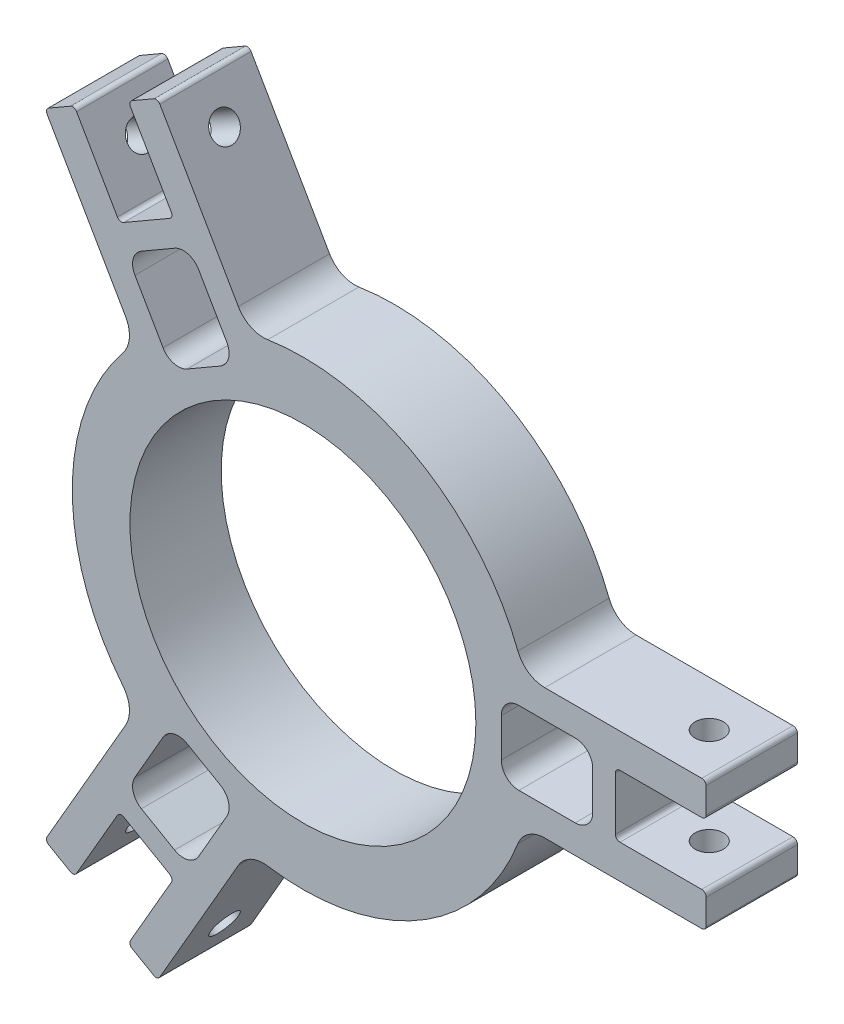
from build123d import *

# Parameters (mm, degrees)
SKETCH1_R           = 38.1
BOSS_EXTRUDE1_DEPTH = 20.1
SKETCH4_R           = 3.125
CUT_EXTRUDE3_DEPTH  = 144.535934685
SKETCH6_R           = 3.125
CUT_EXTRUDE4_DEPTH  = 127.835550541
SKETCH7_R           = 3.125
CUT_EXTRUDE5_DEPTH  = 156.395985719


with BuildPart() as part:
    # Sketch1 → Boss-Extrude1 (new body)
    with BuildSketch(Plane.XY):
        with BuildLine():
            Line((-95.111903665, 93.55868451), (-99.980615655, 90.747732332))
            ThreePointArc((-99.980615655, 90.747732332), (-100.446541481, 90.140525974), (-100.346641059, 89.381706928))
            Line((-100.346641059, 89.381706928), (-91.346641059, 73.79324966))
            ThreePointArc((-91.346641059, 73.79324966), (-91.246740636, 73.034430615), (-91.712666463, 72.427224257))
            Line((-91.712666463, 72.427224257), (-101.854513828, 66.57182595))
            ThreePointArc((-101.854513828, 66.57182595), (-102.613332873, 66.471925528), (-103.220539232, 66.937851354))
            Line((-103.220539232, 66.937851354), (-112.220539232, 82.526308622))
            ThreePointArc((-112.220539232, 82.526308622), (-112.82774559, 82.992234449), (-113.586564635, 82.892334026))
            Line((-113.586564635, 82.892334026), (-118.455276625, 80.081381848))
            ThreePointArc((-118.455276625, 80.081381848), (-118.819948321, 79.484414756), (-118.704168635, 78.7945233))
            Line((-118.704168635, 78.7945233), (-101.414254717, 48.847513936))
            ThreePointArc((-101.414254717, 48.847513936), (-100.582142307, 45.186502855), (-101.963268876, 41.695385184))
            ThreePointArc((-101.963268876, 41.695385184), (-113.159955971, 10.246732396), (-102.420535507, -21.3609947))
            ThreePointArc((-102.420535507, -21.3609947), (-102.19294947, -21.65066375), (-101.963268876, -21.938674838))
            ThreePointArc((-101.963268876, -21.938674838), (-100.582142307, -25.429792509), (-101.414254717, -29.09080359))
            Line((-101.414254717, -29.09080359), (-118.704168635, -59.037812955))
            ThreePointArc((-118.704168635, -59.037812955), (-118.819948321, -59.72770441), (-118.455276625, -60.324671502))
            Line((-118.455276625, -60.324671502), (-113.586564635, -63.13562368))
            ThreePointArc((-113.586564635, -63.13562368), (-112.82774559, -63.235524103), (-112.220539232, -62.769598276))
            Line((-112.220539232, -62.769598276), (-103.220539232, -47.181141008))
            ThreePointArc((-103.220539232, -47.181141008), (-102.613332873, -46.715215182), (-101.854513828, -46.815115605))
            Line((-101.854513828, -46.815115605), (-91.712666463, -52.670513911))
            ThreePointArc((-91.712666463, -52.670513911), (-91.246740636, -53.277720269), (-91.346641059, -54.036539315))
            Line((-91.346641059, -54.036539315), (-100.346641059, -69.624996583))
            ThreePointArc((-100.346641059, -69.624996583), (-100.446541481, -70.383815628), (-99.980615655, -70.991021986))
            Line((-99.980615655, -70.991021986), (-95.111903665, -73.801974164))
            ThreePointArc((-95.111903665, -73.801974164), (-94.41257915, -73.819305571), (-93.873005467, -73.374091694))
            Line((-93.873005467, -73.374091694), (-76.583091549, -43.427082329))
            ThreePointArc((-76.583091549, -43.427082329), (-73.828619155, -40.875946303), (-70.11465928, -40.326478162))
            ThreePointArc((-70.11465928, -40.326478162), (-37.280983502, -34.298767231), (-15.277599113, -9.194292739))
            ThreePointArc((-15.277599113, -9.194292739), (-15.140531376, -8.852362925), (-15.005946754, -8.509448151))
            ThreePointArc((-15.005946754, -8.509448151), (-12.673113448, -5.567798621), (-9.086528644, -4.457923566))
            Line((-9.086528644, -4.457923566), (25.493299193, -4.457923566))
            ThreePointArc((25.493299193, -4.457923566), (26.148652562, -4.213245988), (26.483305381, -3.598947489))
            Line((26.483305381, -3.598947489), (26.483305381, 2.022956867))
            ThreePointArc((26.483305381, 2.022956867), (26.190412162, 2.730063648), (25.483305381, 3.022956867))
            Line((25.483305381, 3.022956867), (7.483305381, 3.022956867))
            ThreePointArc((7.483305381, 3.022956867), (6.7761986, 3.315850085), (6.483305381, 4.022956867))
            Line((6.483305381, 4.022956867), (6.483305381, 15.733753479))
            ThreePointArc((6.483305381, 15.733753479), (6.7761986, 16.44086026), (7.483305381, 16.733753479))
            Line((7.483305381, 16.733753479), (25.483305381, 16.733753479))
            ThreePointArc((25.483305381, 16.733753479), (26.190412162, 17.026646698), (26.483305381, 17.733753479))
            Line((26.483305381, 17.733753479), (26.483305381, 23.355657835))
            ThreePointArc((26.483305381, 23.355657835), (26.148652562, 23.969956334), (25.493299193, 24.214633912))
            Line((25.493299193, 24.214633912), (-9.086528644, 24.214633912))
            ThreePointArc((-9.086528644, 24.214633912), (-12.673113448, 25.324508967), (-15.005946754, 28.266158497))
            ThreePointArc((-15.005946754, 28.266158497), (-36.642935435, 53.687100354), (-69.385740289, 60.190352958))
            ThreePointArc((-69.385740289, 60.190352958), (-69.750394063, 60.138092193), (-70.11465928, 60.083188508))
            ThreePointArc((-70.11465928, 60.083188508), (-73.828619155, 60.632656649), (-76.583091549, 63.183792675))
            Line((-76.583091549, 63.183792675), (-93.873005467, 93.13080204))
            ThreePointArc((-93.873005467, 93.13080204), (-94.41257915, 93.576015917), (-95.111903665, 93.55868451))
        make_face()
        with BuildLine():
            ThreePointArc((-97.942547476, -43.300187739), (-99.748010053, -40.947263099), (-99.360895916, -38.006839299))
            Line((-99.360895916, -38.006839299), (-93.165814799, -27.276644048))
            ThreePointArc((-93.165814799, -27.276644048), (-90.812890159, -25.471181471), (-87.87246636, -25.858295608))
            Line((-87.87246636, -25.858295608), (-80.554551698, -30.083295608))
            ThreePointArc((-80.554551698, -30.083295608), (-78.749089121, -32.436220248), (-79.136203258, -35.376644048))
            Line((-79.136203258, -35.376644048), (-85.331284375, -46.106839299))
            ThreePointArc((-85.331284375, -46.106839299), (-87.684209014, -47.912301876), (-90.624632814, -47.525187739))
            Line((-90.624632814, -47.525187739), (-97.942547476, -43.300187739))
        make_face(mode=Mode.SUBTRACT)
        with Locations((-62.361291636, 9.878355173)):
            Circle(SKETCH1_R, mode=Mode.SUBTRACT)
        with BuildLine():
            Line((-80.554551698, 49.840005954), (-87.87246636, 45.615005954))
            ThreePointArc((-87.87246636, 45.615005954), (-90.812890159, 45.227891817), (-93.165814799, 47.033354394))
            Line((-93.165814799, 47.033354394), (-99.360895916, 57.763549645))
            ThreePointArc((-99.360895916, 57.763549645), (-99.748010053, 60.703973445), (-97.942547476, 63.056898085))
            Line((-97.942547476, 63.056898085), (-90.624632814, 67.281898085))
            ThreePointArc((-90.624632814, 67.281898085), (-87.684209014, 67.669012222), (-85.331284375, 65.863549645))
            Line((-85.331284375, 65.863549645), (-79.136203258, 55.133354394))
            ThreePointArc((-79.136203258, 55.133354394), (-78.749089121, 52.192930594), (-80.554551698, 49.840005954))
        make_face(mode=Mode.SUBTRACT)
        with BuildLine():
            ThreePointArc((1.483305381, 5.653355173), (0.348344158, 2.913316396), (-2.391694619, 1.778355173))
            Line((-2.391694619, 1.778355173), (-14.781856852, 1.778355173))
            ThreePointArc((-14.781856852, 1.778355173), (-17.521895629, 2.913316396), (-18.656856852, 5.653355173))
            Line((-18.656856852, 5.653355173), (-18.656856852, 14.103355173))
            ThreePointArc((-18.656856852, 14.103355173), (-17.521895629, 16.84339395), (-14.781856852, 17.978355173))
            Line((-14.781856852, 17.978355173), (-2.391694619, 17.978355173))
            ThreePointArc((-2.391694619, 17.978355173), (0.348344158, 16.84339395), (1.483305381, 14.103355173))
            Line((1.483305381, 14.103355173), (1.483305381, 5.653355173))
        make_face(mode=Mode.SUBTRACT)
    extrude(amount=BOSS_EXTRUDE1_DEPTH)

    # Sketch4 → Cut-Extrude3 (cut, through all)
    with BuildSketch(Plane(origin=(-30.07793388, -17.365503222, 0), x_dir=(0, 0, -1), z_dir=(0.8660254037844387, 0.49999999999999983, 0))):
        with Locations((-10.05, 119.190143175)):
            Circle(SKETCH4_R)
    extrude(amount=-CUT_EXTRUDE3_DEPTH, mode=Mode.SUBTRACT)

    # Sketch6 → Cut-Extrude4 (cut, through all)
    with BuildSketch(Plane(origin=(-38.632840407, 22.304680809, 0), x_dir=(0, 0, -1), z_dir=(0.8660254037844342, -0.5000000000000079, 0))):
        with Locations((-10.05, -102.08033012)):
            Circle(SKETCH6_R)
    extrude(amount=-CUT_EXTRUDE4_DEPTH, mode=Mode.SUBTRACT)

    # Sketch7 → Cut-Extrude5 (cut, through all)
    with BuildSketch(Plane(origin=(0, 24.214633912, 0), x_dir=(1, 0, 0), z_dir=(0, 1, 0))):
        with Locations((17.093299193, -10.05)):
            Circle(SKETCH7_R)
    extrude(amount=-CUT_EXTRUDE5_DEPTH, mode=Mode.SUBTRACT)


solid = part.part
